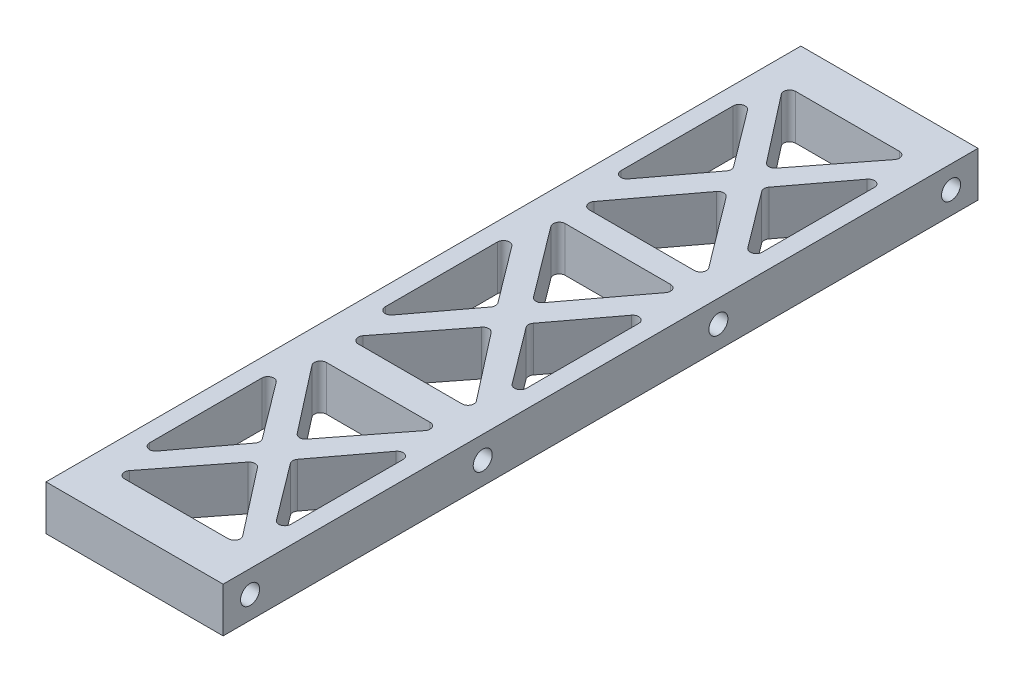
from build123d import *

# Parameters (mm, degrees)
SKETCH1_W                       = 37.6
SKETCH1_H                       = 150.080000068
BOSS_EXTRUDE1_DEPTH             = 9.525
CUT_EXTRUDE1_DEPTH              = 762.696556761
SKETCH7_W                       = 37.6
SKETCH7_H                       = 9.525
BOSS_EXTRUDE3_DEPTH             = 2.54
SKETCH8_W                       = 37.6
SKETCH8_H                       = 9.525
BOSS_EXTRUDE4_DEPTH             = 2.54
F_10_32_TAPPED_HOLE1_AT_2_COUNT = 2
F_10_32_TAPPED_HOLE1_AT_2_PITCH = 49.391666689
F_10_32_TAPPED_HOLE1_AT_3_COUNT = 2
F_10_32_TAPPED_HOLE1_AT_3_PITCH = 99.418333379
F_10_32_TAPPED_HOLE1_AT_4_COUNT = 2
F_10_32_TAPPED_HOLE1_AT_4_PITCH = 148.810000068
SKETCH12_W                      = 37.6
SKETCH12_H                      = 9.525
BOSS_EXTRUDE7_DEPTH             = 2.54
SKETCH13_W                      = 37.6
SKETCH13_H                      = 9.525
BOSS_EXTRUDE8_DEPTH             = 2.54


with BuildPart() as part:
    # Sketch1 → Boss-Extrude1 (new body)
    with BuildSketch(Plane(origin=(0, 0, 0), x_dir=(1, 0, 0), z_dir=(0, 1, 0))):
        with Locations((-739.13134079, 0)):
            Rectangle(SKETCH1_W, SKETCH1_H)
    extrude(amount=BOSS_EXTRUDE1_DEPTH)

    # Sketch3 → Cut-Extrude1 (cut, through all)
    with BuildSketch(Plane(origin=(0, 9.525, 0), x_dir=(1, 0, 0), z_dir=(0, 1, 0))):
        with BuildLine():
            Line((-740.146560985, 44.448348813), (-751.316810094, 29.586371977))
            ThreePointArc((-751.316810094, 29.586371977), (-751.437802701, 28.255952989), (-750.301589899, 27.553333345))
            Line((-750.301589899, 27.553333345), (-727.961091681, 27.553333345))
            ThreePointArc((-727.961091681, 27.553333345), (-726.824878879, 28.255952989), (-726.945871486, 29.586371977))
            Line((-726.945871486, 29.586371977), (-738.116120595, 44.448348813))
            ThreePointArc((-738.116120595, 44.448348813), (-739.13134079, 44.95531018), (-740.146560985, 44.448348813))
        make_face()
        with BuildLine():
            Line((-750.301589899, 22.473333345), (-727.961091681, 22.473333345))
            ThreePointArc((-727.961091681, 22.473333345), (-726.824878879, 21.770713701), (-726.945871486, 20.440294712))
            Line((-726.945871486, 20.440294712), (-738.116120595, 5.578317877))
            ThreePointArc((-738.116120595, 5.578317877), (-739.13134079, 5.071356509), (-740.146560985, 5.578317877))
            Line((-740.146560985, 5.578317877), (-751.316810094, 20.440294712))
            ThreePointArc((-751.316810094, 20.440294712), (-751.437802701, 21.770713701), (-750.301589899, 22.473333345))
        make_face()
        with BuildLine():
            Line((-751.836120595, 62.702760168), (-742.882278736, 50.789705322))
            ThreePointArc((-742.882278736, 50.789705322), (-742.627498932, 50.026666689), (-742.882278736, 49.263628057))
            Line((-742.882278736, 49.263628057), (-751.836120595, 37.35057321))
            ThreePointArc((-751.836120595, 37.35057321), (-753.25356607, 36.908989568), (-754.12134079, 38.113611843))
            Line((-754.12134079, 38.113611843), (-754.12134079, 61.939721536))
            ThreePointArc((-754.12134079, 61.939721536), (-753.25356607, 63.14434381), (-751.836120595, 62.702760168))
        make_face()
        with BuildLine():
            Line((-750.140322408, 71.230000034), (-728.122359171, 71.230000034))
            ThreePointArc((-728.122359171, 71.230000034), (-726.981472153, 70.517921903), (-727.119956309, 69.180199738))
            Line((-727.119956309, 69.180199738), (-738.128937927, 55.028583297))
            ThreePointArc((-738.128937927, 55.028583297), (-739.13134079, 54.538383593), (-740.133743652, 55.028583297))
            Line((-740.133743652, 55.028583297), (-751.142725271, 69.180199738))
            ThreePointArc((-751.142725271, 69.180199738), (-751.281209426, 70.517921903), (-750.140322408, 71.230000034))
        make_face()
        with BuildLine():
            Line((-740.133743652, -5.425249933), (-751.142725271, -19.576866374))
            ThreePointArc((-751.142725271, -19.576866374), (-751.281209426, -20.914588539), (-750.140322408, -21.62666667))
            Line((-750.140322408, -21.62666667), (-728.122359171, -21.62666667))
            ThreePointArc((-728.122359171, -21.62666667), (-726.981472153, -20.914588539), (-727.119956309, -19.576866374))
            Line((-727.119956309, -19.576866374), (-738.128937927, -5.425249933))
            ThreePointArc((-738.128937927, -5.425249933), (-739.13134079, -4.935050229), (-740.133743652, -5.425249933))
        make_face()
        with BuildLine():
            Line((-727.119956309, -30.449800315), (-738.128937927, -44.601416756))
            ThreePointArc((-738.128937927, -44.601416756), (-739.13134079, -45.091616461), (-740.133743652, -44.601416756))
            Line((-740.133743652, -44.601416756), (-751.142725271, -30.449800315))
            ThreePointArc((-751.142725271, -30.449800315), (-751.281209426, -29.11207815), (-750.140322408, -28.400000019))
            Line((-750.140322408, -28.400000019), (-728.122359171, -28.400000019))
            ThreePointArc((-728.122359171, -28.400000019), (-726.981472153, -29.11207815), (-727.119956309, -30.449800315))
        make_face()
        with BuildLine():
            Line((-750.140322408, -71.230000034), (-728.122359171, -71.230000034))
            ThreePointArc((-728.122359171, -71.230000034), (-726.981472153, -70.517921903), (-727.119956309, -69.180199738))
            Line((-727.119956309, -69.180199738), (-738.128937927, -55.028583297))
            ThreePointArc((-738.128937927, -55.028583297), (-739.13134079, -54.538383593), (-740.133743652, -55.028583297))
            Line((-740.133743652, -55.028583297), (-751.142725271, -69.180199738))
            ThreePointArc((-751.142725271, -69.180199738), (-751.281209426, -70.517921903), (-750.140322408, -71.230000034))
        make_face()
        with BuildLine():
            Line((-754.12134079, 11.913054846), (-754.12134079, -11.913054846))
            ThreePointArc((-754.12134079, -11.913054846), (-753.25356607, -13.117677121), (-751.836120595, -12.676093479))
            Line((-751.836120595, -12.676093479), (-742.882278736, -0.763038633))
            ThreePointArc((-742.882278736, -0.763038633), (-742.627498932, 0), (-742.882278736, 0.763038633))
            Line((-742.882278736, 0.763038633), (-751.836120595, 12.676093479))
            ThreePointArc((-751.836120595, 12.676093479), (-753.25356607, 13.117677121), (-754.12134079, 11.913054846))
        make_face()
        with BuildLine():
            Line((-742.882278736, -50.789705322), (-751.836120595, -62.702760168))
            ThreePointArc((-751.836120595, -62.702760168), (-753.25356607, -63.14434381), (-754.12134079, -61.939721536))
            Line((-754.12134079, -61.939721536), (-754.12134079, -38.113611843))
            ThreePointArc((-754.12134079, -38.113611843), (-753.25356607, -36.908989568), (-751.836120595, -37.35057321))
            Line((-751.836120595, -37.35057321), (-742.882278736, -49.263628057))
            ThreePointArc((-742.882278736, -49.263628057), (-742.627498932, -50.026666689), (-742.882278736, -50.789705322))
        make_face()
        with BuildLine():
            Line((-726.426560985, -37.35057321), (-735.380402843, -49.263628057))
            ThreePointArc((-735.380402843, -49.263628057), (-735.635182648, -50.026666689), (-735.380402843, -50.789705322))
            Line((-735.380402843, -50.789705322), (-726.426560985, -62.702760168))
            ThreePointArc((-726.426560985, -62.702760168), (-725.00911551, -63.14434381), (-724.14134079, -61.939721536))
            Line((-724.14134079, -61.939721536), (-724.14134079, -38.113611843))
            ThreePointArc((-724.14134079, -38.113611843), (-725.00911551, -36.908989568), (-726.426560985, -37.35057321))
        make_face()
        with BuildLine():
            Line((-735.380402843, 0.763038633), (-726.426560985, 12.676093479))
            ThreePointArc((-726.426560985, 12.676093479), (-725.00911551, 13.117677121), (-724.14134079, 11.913054846))
            Line((-724.14134079, 11.913054846), (-724.14134079, -11.913054846))
            ThreePointArc((-724.14134079, -11.913054846), (-725.00911551, -13.117677121), (-726.426560985, -12.676093479))
            Line((-726.426560985, -12.676093479), (-735.380402843, -0.763038633))
            ThreePointArc((-735.380402843, -0.763038633), (-735.635182648, 0), (-735.380402843, 0.763038633))
        make_face()
        with BuildLine():
            Line((-724.14134079, 38.113611843), (-724.14134079, 61.939721536))
            ThreePointArc((-724.14134079, 61.939721536), (-725.00911551, 63.14434381), (-726.426560985, 62.702760168))
            Line((-726.426560985, 62.702760168), (-735.380402843, 50.789705322))
            ThreePointArc((-735.380402843, 50.789705322), (-735.635182648, 50.026666689), (-735.380402843, 49.263628057))
            Line((-735.380402843, 49.263628057), (-726.426560985, 37.35057321))
            ThreePointArc((-726.426560985, 37.35057321), (-725.00911551, 36.908989568), (-724.14134079, 38.113611843))
        make_face()
    extrude(amount=-CUT_EXTRUDE1_DEPTH, mode=Mode.SUBTRACT)

    # Sketch7 → Boss-Extrude3 (add)
    with BuildSketch(Plane.XY.offset(75.040000034)):
        with Locations((-739.13134079, 4.7625)):
            Rectangle(SKETCH7_W, SKETCH7_H)
    extrude(amount=BOSS_EXTRUDE3_DEPTH)

    # Sketch8 → Boss-Extrude4 (add)
    with BuildSketch(Plane(origin=(0, 0, -75.040000034), x_dir=(-1, 0, 0), z_dir=(0, 0, -1))):
        with Locations((739.13134079, 4.7625)):
            Rectangle(SKETCH8_W, SKETCH8_H)
    extrude(amount=BOSS_EXTRUDE4_DEPTH)

    # Sketch11 → #10-32 Tapped Hole1 (revolve, cut)
    with BuildSketch(Plane(origin=(-720.33134079, 4.7625, 74.405000034), x_dir=(0, 0, -1), z_dir=(0, 1, 0))):
        Polygon((0, 0), (0, 14.929317848), (2.0193, 13.716), (2.0193, 0), align=None)
    f_10_32_tapped_hole1 = revolve(axis=Axis((-713.98134079, 4.7625, 74.405000034), (-1, 0, 0)), mode=Mode.SUBTRACT)

    # #10-32 Tapped Hole1 at 2: #10-32 Tapped Hole1 ×2
    with Locations(*[(0, 0, -i * F_10_32_TAPPED_HOLE1_AT_2_PITCH) for i in range(1, F_10_32_TAPPED_HOLE1_AT_2_COUNT)]):
        add(f_10_32_tapped_hole1, mode=Mode.SUBTRACT)

    # #10-32 Tapped Hole1 at 3: #10-32 Tapped Hole1 ×2
    with Locations(*[(0, 0, -i * F_10_32_TAPPED_HOLE1_AT_3_PITCH) for i in range(1, F_10_32_TAPPED_HOLE1_AT_3_COUNT)]):
        add(f_10_32_tapped_hole1, mode=Mode.SUBTRACT)

    # #10-32 Tapped Hole1 at 4: #10-32 Tapped Hole1 ×2
    with Locations(*[(0, 0, -i * F_10_32_TAPPED_HOLE1_AT_4_PITCH) for i in range(1, F_10_32_TAPPED_HOLE1_AT_4_COUNT)]):
        add(f_10_32_tapped_hole1, mode=Mode.SUBTRACT)

    # Mirror1: #10-32 Tapped Hole1 across plane
    add(f_10_32_tapped_hole1.mirror(Plane.ZY.offset(739.13134079)), mode=Mode.SUBTRACT)

    # Mirror1 copy 1 sketch → Mirror1 copy 1 (revolve, cut)
    with BuildSketch(Plane(origin=(-757.93134079, 4.7625, 25.013333345), x_dir=(0, 0, -1), z_dir=(0, 1, 0))):
        Polygon((0, 0), (0, -14.929317848), (2.0193, -13.716), (2.0193, 0), align=None)
    revolve(axis=Axis((-764.28134079, 4.7625, 25.013333345), (-1, 0, 0)), mode=Mode.SUBTRACT)

    # Mirror1 copy 2 sketch → Mirror1 copy 2 (revolve, cut)
    with BuildSketch(Plane(origin=(-757.93134079, 4.7625, -25.013333345), x_dir=(0, 0, -1), z_dir=(0, 1, 0))):
        Polygon((0, 0), (0, -14.929317848), (2.0193, -13.716), (2.0193, 0), align=None)
    revolve(axis=Axis((-764.28134079, 4.7625, -25.013333345), (-1, 0, 0)), mode=Mode.SUBTRACT)

    # Mirror1 copy 3 sketch → Mirror1 copy 3 (revolve, cut)
    with BuildSketch(Plane(origin=(-757.93134079, 4.7625, -74.405000034), x_dir=(0, 0, -1), z_dir=(0, 1, 0))):
        Polygon((0, 0), (0, -14.929317848), (2.0193, -13.716), (2.0193, 0), align=None)
    revolve(axis=Axis((-764.28134079, 4.7625, -74.405000034), (-1, 0, 0)), mode=Mode.SUBTRACT)

    # Sketch12 → Boss-Extrude7 (add)
    with BuildSketch(Plane(origin=(0, 0, -77.580000034), x_dir=(-1, 0, 0), z_dir=(0, 0, -1))):
        with Locations((739.13134079, 4.7625)):
            Rectangle(SKETCH12_W, SKETCH12_H)
    extrude(amount=BOSS_EXTRUDE7_DEPTH)

    # Sketch13 → Boss-Extrude8 (add)
    with BuildSketch(Plane.XY.offset(77.580000034)):
        with Locations((-739.13134079, 4.7625)):
            Rectangle(SKETCH13_W, SKETCH13_H)
    extrude(amount=BOSS_EXTRUDE8_DEPTH)


solid = part.part
